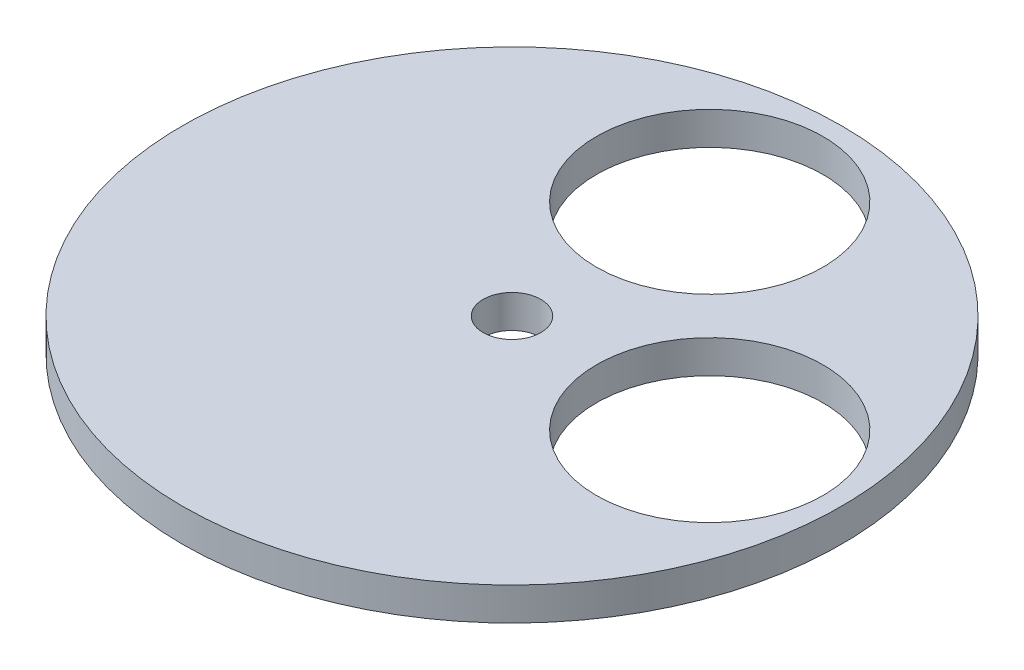
from build123d import *

# Parameters (mm, degrees)
SKETCH6_R           = 50.8
BOSS_EXTRUDE3_DEPTH = 5.08
SKETCH11_R          = 17.4625
CUT_EXTRUDE2_DEPTH  = 162.724414978
SKETCH12_R          = 4.445
CUT_EXTRUDE3_DEPTH  = 162.724414978


with BuildPart() as part:
    # Sketch6 → Boss-Extrude3 (new body)
    with BuildSketch(Plane(origin=(0, 0, 0), x_dir=(1, 0, 0), z_dir=(0, 1, 0))):
        with Locations((63.5, 63.5)):
            Circle(SKETCH6_R)
    extrude(amount=BOSS_EXTRUDE3_DEPTH)

    # Sketch11 → Cut-Extrude2 (cut, through all)
    with BuildSketch(Plane(origin=(0, 5.08, 0), x_dir=(1, 0, 0), z_dir=(0, 1, 0))):
        with Locations((63.5, 93.98)):
            Circle(SKETCH11_R)
        with Locations((93.98, 63.5)):
            Circle(SKETCH11_R)
    extrude(amount=-CUT_EXTRUDE2_DEPTH, mode=Mode.SUBTRACT)

    # Sketch12 → Cut-Extrude3 (cut, through all)
    with BuildSketch(Plane(origin=(0, 5.08, 0), x_dir=(1, 0, 0), z_dir=(0, 1, 0))):
        with Locations((63.5, 63.5)):
            Circle(SKETCH12_R)
    extrude(amount=-CUT_EXTRUDE3_DEPTH, mode=Mode.SUBTRACT)


solid = part.part
